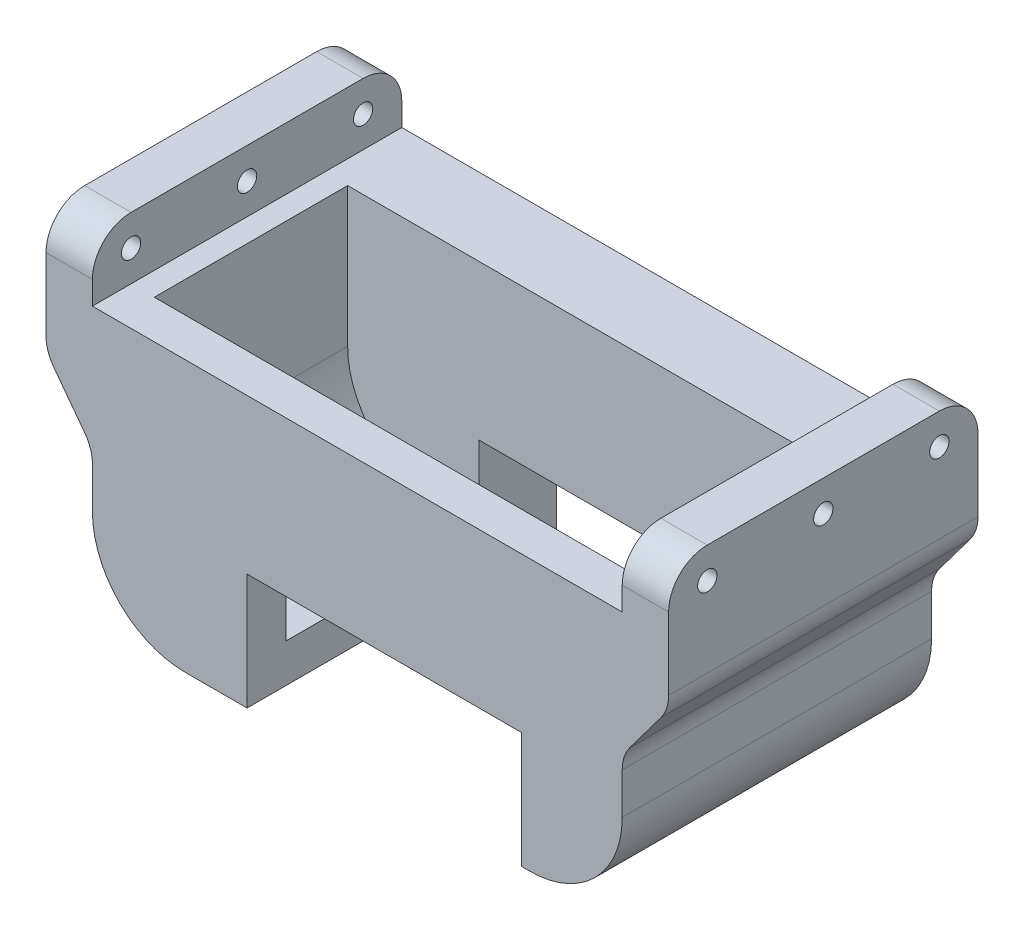
from build123d import *

# Parameters (mm, degrees)
BOSS_EXTRUDE1_DEPTH     = 40
SKETCH2_W               = 35.5
SKETCH2_H               = 25
CUT_EXTRUDE1_DEPTH      = 40
CUT_EXTRUDE2_DEPTH      = 67.671301922
CUT_EXTRUDE2_DEPTH_BACK = 67.671301922
SKETCH3_R               = 1.25
FILLET2_R               = 5
CHAMFER1_SIZE           = 5
SKETCH4_W               = 17
SKETCH4_H               = 25
SKETCH4_W_2             = 10
CUT_EXTRUDE3_DEPTH      = 30
FILLET3_R               = 12


with BuildPart() as part:
    # Sketch1 → Boss-Extrude1 (new body)
    with BuildSketch(Plane.XY):
        Polygon((-14.25, -20), (21.25, -20), (21.25, -35), (34.25, -35), (34.25, 0), (-34.25, 0), (-34.25, -35), (-14.25, -35), align=None)
        Polygon((-34.25, -16), (-34.25, 0), (-34.25, 8), (-40.25, 8), (-40.25, -8), align=None)
        Polygon((34.25, 8), (34.25, 0), (34.25, -16), (40.25, -8), (40.25, 8), align=None)
    extrude(amount=BOSS_EXTRUDE1_DEPTH)

    # Sketch2 → Cut-Extrude1 (cut)
    with BuildSketch(Plane(origin=(0, 0, 0), x_dir=(1, 0, 0), z_dir=(0, 1, 0))):
        with Locations((3.5, -22.5)):
            Rectangle(SKETCH2_W, SKETCH2_H)
    extrude(amount=-CUT_EXTRUDE1_DEPTH, mode=Mode.SUBTRACT)

    # Sketch3 → Cut-Extrude2 (cut, two sides: drawn at the far end of the back side and taken through both)
    with BuildSketch(Plane(origin=(0, 0, 0), x_dir=(0, 0, -1), z_dir=(1, 0, 0)).offset(-CUT_EXTRUDE2_DEPTH_BACK)):
        with Locations((-35, 4)):
            Circle(SKETCH3_R)
        with Locations((-5, 4)):
            Circle(SKETCH3_R)
        with Locations((-20, 4)):
            Circle(SKETCH3_R)
    extrude(amount=CUT_EXTRUDE2_DEPTH + CUT_EXTRUDE2_DEPTH_BACK, mode=Mode.SUBTRACT)

    # Fillet2
    fillet2_edges = [part.edges().sort_by_distance(p)[0] for p in [
        (-37.25, 8, 0),
        (37.25, 8, 0),
        (37.25, 8, 40),
        (-34.25, -16, 20),
        (-40.25, -8, 20),
        (40.25, -8, 20),
        (34.25, -16, 20),
        (-37.25, 8, 40),
    ]]
    fillet(fillet2_edges, radius=FILLET2_R)

    # Chamfer1
    chamfer1_edges = [part.edges().sort_by_distance(p)[0] for p in [
        (21.25, -27.5, 0),
    ]]
    chamfer(chamfer1_edges, length=CHAMFER1_SIZE)

    # Sketch4 → Cut-Extrude3 (cut)
    with BuildSketch(Plane(origin=(0, 0, 0), x_dir=(1, 0, 0), z_dir=(0, 1, 0))):
        with Locations((-22.75, -22.5)):
            Rectangle(SKETCH4_W, SKETCH4_H)
        with Locations((26.25, -22.5)):
            Rectangle(SKETCH4_W_2, SKETCH4_H)
    extrude(amount=-CUT_EXTRUDE3_DEPTH, mode=Mode.SUBTRACT)

    # Fillet3
    # the kernel refuses this fillet: 12 mm, written as the material it adds along each edge
    with BuildSketch(Plane(origin=(-31.25, -30, 10), x_dir=(0, 1, 0), z_dir=(0, 0, 1))) as fillet3_piece_1_section:
        with BuildLine():
            CenterArc((FILLET3_R, -FILLET3_R), FILLET3_R, 90, 90)
            Line((0, -FILLET3_R), (0, 0))
            Line((0, 0), (FILLET3_R, 0))
        make_face()
    fillet3_piece_1 = extrude(amount=55, mode=Mode.PRIVATE)
    fillet3_piece_1 = split(fillet3_piece_1, bisect_by=Plane(origin=(-31.25, -30, 40), z_dir=(0, 0, -1)), keep=Keep.TOP, mode=Mode.PRIVATE)
    add(fillet3_piece_1)
    with BuildSketch(Plane(origin=(31.25, -30, 10), x_dir=(0, 1, 0), z_dir=(0, 0, 1))) as fillet3_piece_2_section:
        with BuildLine():
            CenterArc((11.832159566, 12), FILLET3_R, 189.594068227, 80.405931773)
            Line((0, 10), (0, 0))
            Line((0, 0), (11.832159566, 0))
        make_face()
    fillet3_piece_2 = extrude(amount=54.580398916, mode=Mode.PRIVATE)
    fillet3_piece_2 = split(fillet3_piece_2, bisect_by=Plane(origin=(31.25, -30, 40), z_dir=(0, 0, -1)), keep=Keep.TOP, mode=Mode.PRIVATE)
    add(fillet3_piece_2)
    # the kernel refuses this fillet: 12 mm, written as the material it takes off along each edge
    with BuildSketch(Plane(origin=(-34.25, -35, -30), x_dir=(1, 0, 0), z_dir=(0, 0, 1)), Plane(origin=(34.25, -35, -30), x_dir=(0, 1, 0), z_dir=(0, 0, 1))) as fillet3_2_piece_1:
        with BuildLine():
            CenterArc((FILLET3_R, FILLET3_R), FILLET3_R, 180, 90)
            Line((0, FILLET3_R), (0, 0))
            Line((0, 0), (FILLET3_R, 0))
        make_face()
    extrude(amount=100, mode=Mode.SUBTRACT)


solid = part.part
